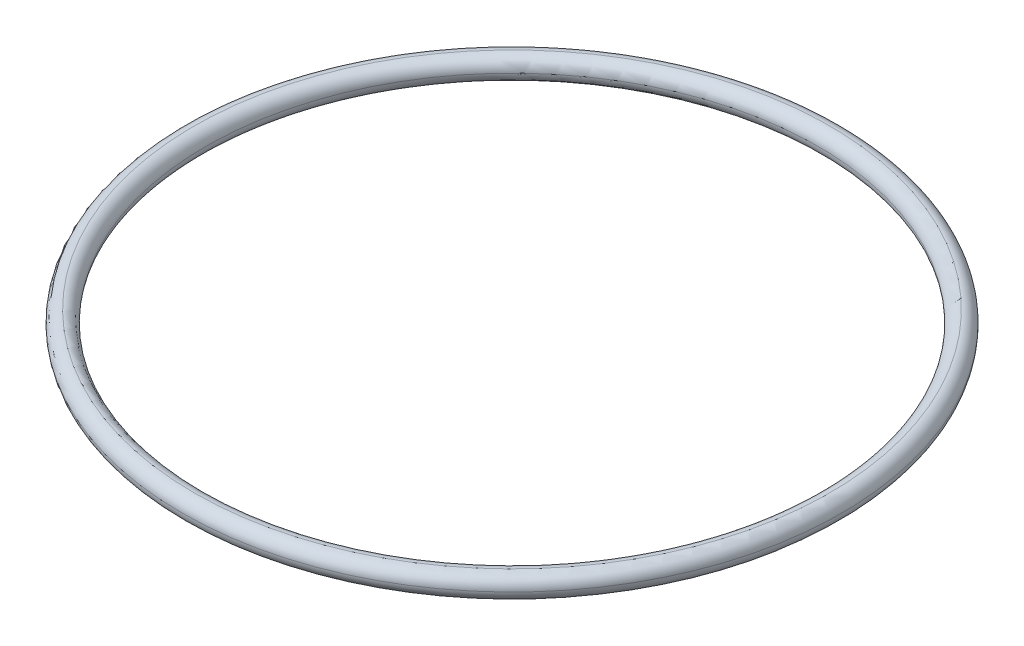
from build123d import *

# Parameters (mm, degrees)
ESBO_O1_R                = 35
ESBO_O1_R_2              = 32.5
RESSALTO_EXTRUS_O1_DEPTH = 2.5
FILETE3_R                = 1.25


with BuildPart() as part:
    # Esboço1 → Ressalto-extrusão1 (new body)
    with BuildSketch(Plane(origin=(0, 0, 0), x_dir=(1, 0, 0), z_dir=(0, 1, 0))):
        with Locations(Location((0, 0, 0), (0, 0, 270))):
            Circle(ESBO_O1_R)
        with Locations(Location((0, 0, 0), (0, 0, 270))):
            Circle(ESBO_O1_R_2, mode=Mode.SUBTRACT)
    extrude(amount=RESSALTO_EXTRUS_O1_DEPTH)

    # Filete3
    filete3_edges = [part.edges().sort_by_distance(p)[0] for p in [
        (0, 0, -35),
        (0, 2.5, -35),
        (0, 0, -32.5),
        (0, 2.5, -32.5),
    ]]
    fillet(filete3_edges, radius=FILETE3_R - 0.0001)  # a hair under: the kernel refuses the full size


solid = part.part
